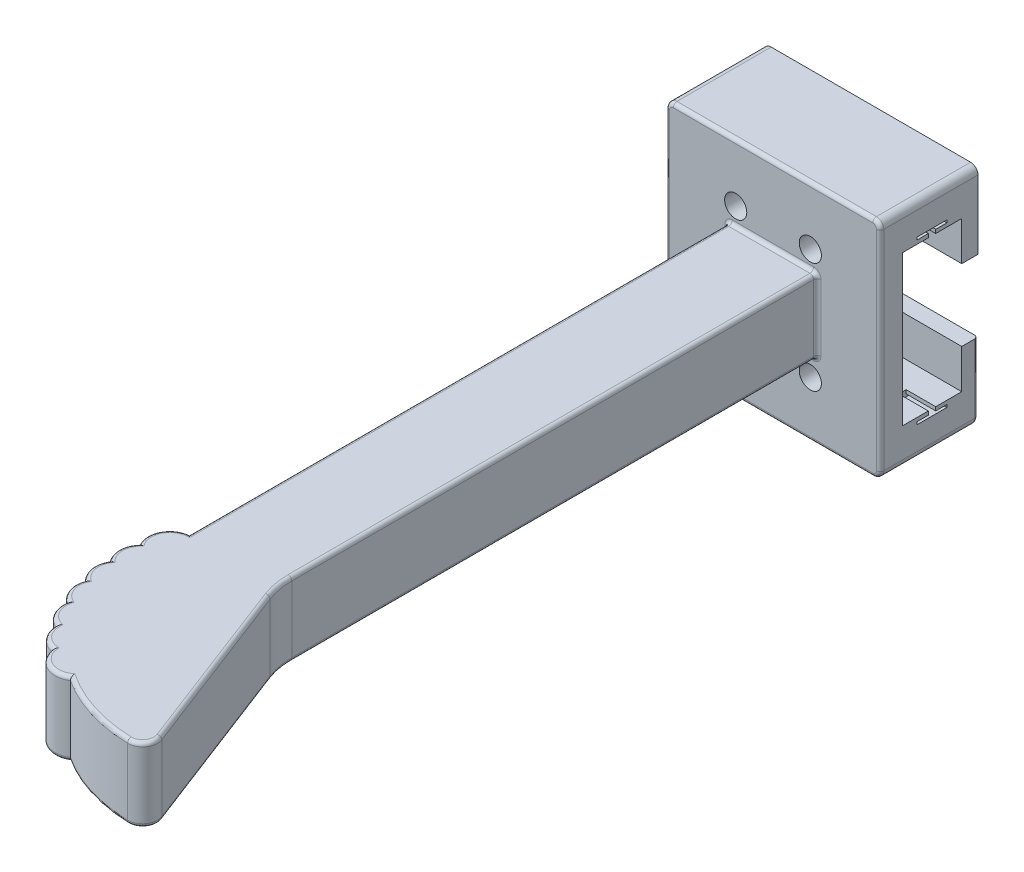
from build123d import *

# Parameters (mm, degrees)
BOSS_EXTRU_1_DEPTH           = 13.25
BOSS_EXTRU_1_2_DEPTH         = 13.25
ESQUISSE2_W                  = 29
ESQUISSE2_H                  = 3
BOSS_EXTRU_2_DEPTH           = 20.3
ESQUISSE3_W                  = 29
ESQUISSE3_H                  = 2.2
BOSS_EXTRU_3_DEPTH           = 5.3
ENL_V_MAT_EXTRU_2_DEPTH      = 4
SYM_TRIE3_COPY_1_DEPTH       = 4
ESQUISSE5_R                  = 1.5
ENL_V_MAT_EXTRU_3_DEPTH      = 10
BOSS_EXTRU_4_DEPTH           = 5
BOSS_EXTRU_4_DEPTH_BACK      = 5
BOSS_EXTRU_5_START           = -10
BOSS_EXTRU_5_DEPTH           = 10
R_P_TITION_CIRCULAIRE1_COUNT = 7
R_P_TITION_CIRCULAIRE1_ANGLE = 60
ESQUISSE10_R                 = 1.5
ENL_V_MAT_EXTRU_4_DEPTH      = 2.2
CONG_2_R                     = 0.5
CONG_3_R                     = 0.5


with BuildPart() as part:
    # Esquisse1 → Boss.-Extru.1 (new body)
    with BuildSketch(Plane.XY):
        with BuildLine():
            Line((-14.5, 10.15), (14.5, 10.15))
            Line((14.5, 10.15), (14.5, 14.15))
            ThreePointArc((14.5, 14.15), (14.207106781, 14.857106781), (13.5, 15.15))
            Line((13.5, 15.15), (-13.5, 15.15))
            ThreePointArc((-13.5, 15.15), (-14.207106781, 14.857106781), (-14.5, 14.15))
            Line((-14.5, 14.15), (-14.5, 10.15))
        make_face()
    extrude(amount=BOSS_EXTRU_1_DEPTH)



with BuildPart() as body_2:
    # Esquisse1 → Boss.-Extru.1 2 (new body)
    with BuildSketch(Plane.XY):
        with BuildLine():
            Line((-14.5, -10.15), (14.5, -10.15))
            Line((14.5, -10.15), (14.5, -14.15))
            ThreePointArc((14.5, -14.15), (14.207106781, -14.857106781), (13.5, -15.15))
            Line((13.5, -15.15), (-13.5, -15.15))
            ThreePointArc((-13.5, -15.15), (-14.207106781, -14.857106781), (-14.5, -14.15))
            Line((-14.5, -14.15), (-14.5, -10.15))
        make_face()
    extrude(amount=BOSS_EXTRU_1_2_DEPTH)


with BuildPart() as part_1:
    add(part.part)

    add(body_2.part)  # Boss.-Extru.2 merges body 2
    # Esquisse2 → Boss.-Extru.2 (add)
    with BuildSketch(Plane.XZ.offset(-10.15)):
        with Locations((0, 11.75)):
            Rectangle(ESQUISSE2_W, ESQUISSE2_H)
    extrude(amount=BOSS_EXTRU_2_DEPTH)

    # Esquisse3 → Boss.-Extru.3 (add)
    with BuildSketch(Plane(origin=(0, -10.15, 0), x_dir=(1, 0, 0), z_dir=(0, 1, 0))):
        with Locations((0, -1.1)):
            Rectangle(ESQUISSE3_W, ESQUISSE3_H)
    boss_extru_3 = extrude(amount=BOSS_EXTRU_3_DEPTH)

    # Symétrie1: Boss.-Extru.3 across plane
    add(boss_extru_3.mirror(Plane.ZX))

    # Esquisse4 → Enlèv. mat.-Extru.2 (cut)
    with BuildSketch(Plane.ZY.offset(14.5)):
        Polygon((4.225, -10.999759806), (4.225, -10.65), (5.725, -10.65), (5.725, -10.15), (6.725, -10.15), (6.725, -10.65), (8.225, -10.65), (8.225, -10.999759806), align=None)
    enl_v_mat_extru_2 = extrude(amount=-ENL_V_MAT_EXTRU_2_DEPTH, mode=Mode.SUBTRACT)

    # Symétrie2: Enlèv. mat.-Extru.2 across plane
    add(enl_v_mat_extru_2.mirror(Plane.ZX), mode=Mode.SUBTRACT)

    # Symétrie3: Enlèv. mat.-Extru.2 across plane
    add(enl_v_mat_extru_2.mirror(Plane(origin=(0, 0, 0), x_dir=(0, 0, 1), z_dir=(1, 0, 0))), mode=Mode.SUBTRACT)

    # Symétrie3 copy 1 sketch → Symétrie3 copy 1 (cut)
    with BuildSketch(Plane(origin=(14.5, 0, 0), x_dir=(0, 0, 1), z_dir=(1, 0, 0))):
        Polygon((4.225, -10.999759806), (4.225, -10.65), (5.725, -10.65), (5.725, -10.15), (6.725, -10.15), (6.725, -10.65), (8.225, -10.65), (8.225, -10.999759806), align=None)
    extrude(amount=-SYM_TRIE3_COPY_1_DEPTH, mode=Mode.SUBTRACT)

    # Esquisse5 → Enlèv. mat.-Extru.3 (cut)
    with BuildSketch(Plane.XY.offset(13.25)):
        with Locations((5.05, 7.35)):
            Circle(ESQUISSE5_R)
        with Locations((5.05, -7.65)):
            Circle(ESQUISSE5_R)
        with Locations((-5.05, -7.65)):
            Circle(ESQUISSE5_R)
        with Locations((-5.05, 7.35)):
            Circle(ESQUISSE5_R)
    extrude(amount=-ENL_V_MAT_EXTRU_3_DEPTH, mode=Mode.SUBTRACT)

    # Esquisse6 → Boss.-Extru.4 (add, two sides: drawn at the far end of the back side and taken through both)
    with BuildSketch(Plane(origin=(0, 0, 0), x_dir=(-1, 0, 0), z_dir=(0, -1, 0)).offset(-BOSS_EXTRU_4_DEPTH_BACK)):
        with BuildLine():
            Line((6, -13.25), (-6, -13.25))
            Line((-6, -13.25), (-6, -84.394601238))
            ThreePointArc((-6, -84.394601238), (-6.167804929, -86.218865494), (-6.665588015, -87.981905644))
            Line((-6.665588015, -87.981905644), (-15.824928659, -111.815137902))
            ThreePointArc((-15.824928659, -111.815137902), (-15.592792686, -113.684815833), (-13.909989816, -114.532021344))
            ThreePointArc((-13.909989816, -114.532021344), (3.169311974, -105.406383362), (6, -86.25))
            Line((6, -86.25), (6, -13.25))
        make_face()
    extrude(amount=BOSS_EXTRU_4_DEPTH + BOSS_EXTRU_4_DEPTH_BACK)

    # Esquisse7 → Boss.-Extru.5 (add)
    with BuildSketch(Plane.XZ.offset(5).offset(BOSS_EXTRU_5_START)):
        with BuildLine():
            ThreePointArc((-6, 86.25), (-6.719779668, 89.032190986), (-7.062424079, 91.885481063))
            ThreePointArc((-7.062424079, 91.885481063), (-8.612421183, 88.67538242), (-6, 86.25))
        make_face()
    boss_extru_5 = extrude(amount=BOSS_EXTRU_5_DEPTH)

    # Répétition circulaire1: Boss.-Extru.5 ×7 about axis
    r_p_tition_circulaire1_axis = Axis((14.427061648, 0, 93.018880526), (0, 1, 0))
    for i in range(1, R_P_TITION_CIRCULAIRE1_COUNT):
        add(boss_extru_5.rotate(r_p_tition_circulaire1_axis, i * R_P_TITION_CIRCULAIRE1_ANGLE / (R_P_TITION_CIRCULAIRE1_COUNT - 1)))

    # Esquisse10 → Enlèv. mat.-Extru.4 (cut)
    with BuildSketch(Plane(origin=(0, 0, 0), x_dir=(-1, 0, 0), z_dir=(0, 0, -1))):
        with Locations((0, 7.5)):
            Circle(ESQUISSE10_R)
        with Locations((0, -7.5)):
            Circle(ESQUISSE10_R)
    extrude(amount=-ENL_V_MAT_EXTRU_4_DEPTH, mode=Mode.SUBTRACT)

    # Congé2
    # the kernel refuses this fillet: 0.5 mm, written as the material it takes off along each edge
    with BuildSketch(Plane(origin=(-6, 5, 87.5), x_dir=(0, -1, 0), z_dir=(0, 0, -1))) as cong_2_piece_1_section:
        with BuildLine():
            CenterArc((CONG_2_R, -CONG_2_R), CONG_2_R, 90, 90)
            Line((0, -CONG_2_R), (0, 0))
            Line((0, 0), (CONG_2_R, 0))
        make_face()
    cong_2_piece_1 = extrude(amount=74.25, mode=Mode.PRIVATE)
    cong_2_piece_1 = cong_2_piece_1 - Plane(origin=(-5.664352932, 4.886796499, 89.231164378), x_dir=(-0.46602371566634865, 0, 0.8847722285631089), z_dir=(0, 1, 0)) * Cylinder(3, 151, mode=Mode.PRIVATE)
    add(cong_2_piece_1, mode=Mode.SUBTRACT)
    with BuildSketch(Plane(origin=(14.427061648, 5, 93.018880526), x_dir=(-0.024028222896260387, 0, 0.9997112805727699), z_dir=(0.9997112805727699, 0, 0.024028222896260387))) as cong_2_piece_2_section:
        with BuildLine():
            CenterArc((21.519353873 - CONG_2_R, CONG_2_R), CONG_2_R, 270, 90)
            Line((21.519353873, CONG_2_R), (21.519353873, 0))
            Line((21.519353873, 0), (21.519353873 - CONG_2_R, 0))
        make_face()
    cong_2_piece_2 = revolve(axis=Axis((14.427061648, 5, 93.018880526), (0, -1, 0)), revolution_arc=34.970570308, mode=Mode.PRIVATE)
    cong_2_piece_2 = cong_2_piece_2 - Plane(origin=(1.101095951, 4.859979727, 108.524697876), x_dir=(0.533223368665452, 0, 0.8459744908146272), z_dir=(0, 1, 0)) * Cylinder(3, 87, mode=Mode.PRIVATE)
    add(cong_2_piece_2, mode=Mode.SUBTRACT)
    with BuildSketch(Plane(origin=(13.958046262, 5, 112.532598783), x_dir=(0.9334411984805426, 0, -0.3587304405528035), z_dir=(-0.3587304405528035, 0, -0.9334411984805426))) as cong_2_piece_3:
        with BuildLine():
            CenterArc((2 - CONG_2_R, CONG_2_R), CONG_2_R, 270, 90)
            Line((2, CONG_2_R), (2, 0))
            Line((2, 0), (2 - CONG_2_R, 0))
        make_face()
    revolve(axis=Axis((13.958046262, 5, 112.532598783), (0, -1, 0)), revolution_arc=112.39909676, mode=Mode.SUBTRACT)
    with BuildSketch(Plane(origin=(6.665588015, 5, 87.981905644), x_dir=(-0.9334411984805407, 0, 0.35873044055280795), z_dir=(0.35873044055280795, 0, 0.9334411984805409))) as cong_2_piece_4:
        with BuildLine():
            CenterArc((CONG_2_R, CONG_2_R), CONG_2_R, 180, 90)
            Line((0, CONG_2_R), (0, 0))
            Line((0, 0), (CONG_2_R, 0))
        make_face()
    extrude(amount=25.532655187, mode=Mode.SUBTRACT)
    with BuildSketch(Plane(origin=(16, 5, 84.394601238), x_dir=(-1, 0, 0), z_dir=(0, 0, -1))) as cong_2_piece_5:
        with BuildLine():
            CenterArc((10 + CONG_2_R, -CONG_2_R), CONG_2_R, 90, 90)
            Line((10, -CONG_2_R), (10, 0))
            Line((10, 0), (10 + CONG_2_R, 0))
        make_face()
    revolve(axis=Axis((16, 5, 84.394601238), (0, 1, 0)), revolution_arc=21.022248489, mode=Mode.SUBTRACT)
    with BuildSketch(Plane(origin=(6, 5, 13.25), x_dir=(0, -1, 0), z_dir=(0, 0, 1)), Plane(origin=(6, -5, 13.25), x_dir=(-1, 0, 0), z_dir=(0, 0, 1))) as cong_2_piece_6:
        with BuildLine():
            CenterArc((CONG_2_R, -CONG_2_R), CONG_2_R, 90, 90)
            Line((0, -CONG_2_R), (0, 0))
            Line((0, 0), (CONG_2_R, 0))
        make_face()
    extrude(amount=71.144601238, mode=Mode.SUBTRACT)
    with BuildSketch(Plane(origin=(-6, -5, 87.5), x_dir=(0, 1, 0), z_dir=(0, 0, -1))) as cong_2_piece_7_section:
        with BuildLine():
            CenterArc((CONG_2_R, CONG_2_R), CONG_2_R, 180, 90)
            Line((0, CONG_2_R), (0, 0))
            Line((0, 0), (CONG_2_R, 0))
        make_face()
    cong_2_piece_7 = extrude(amount=74.25, mode=Mode.PRIVATE)
    cong_2_piece_7 = cong_2_piece_7 - Plane(origin=(-5.664352932, -4.886796499, 89.231164378), x_dir=(-0.46602371566634865, 0, 0.8847722285631089), z_dir=(0, 1, 0)) * Cylinder(3, 151, mode=Mode.PRIVATE)
    add(cong_2_piece_7, mode=Mode.SUBTRACT)
    with BuildSketch(Plane(origin=(16, -5, 84.394601238), x_dir=(-1, 0, 0), z_dir=(0, 0, -1))) as cong_2_piece_8:
        with BuildLine():
            CenterArc((10 + CONG_2_R, CONG_2_R), CONG_2_R, 180, 90)
            Line((10, CONG_2_R), (10, 0))
            Line((10, 0), (10 + CONG_2_R, 0))
        make_face()
    revolve(axis=Axis((16, -5, 84.394601238), (0, 1, 0)), revolution_arc=21.022248489, mode=Mode.SUBTRACT)
    with BuildSketch(Plane(origin=(6.665588015, -5, 87.981905644), x_dir=(-0.9334411984805407, 0, 0.35873044055280795), z_dir=(0.35873044055280795, 0, 0.9334411984805409))) as cong_2_piece_9:
        with BuildLine():
            CenterArc((CONG_2_R, -CONG_2_R), CONG_2_R, 90, 90)
            Line((0, -CONG_2_R), (0, 0))
            Line((0, 0), (CONG_2_R, 0))
        make_face()
    extrude(amount=25.532655187, mode=Mode.SUBTRACT)
    with BuildSketch(Plane(origin=(13.958046262, -5, 112.532598783), x_dir=(0.9334411984805426, 0, -0.3587304405528035), z_dir=(-0.3587304405528035, 0, -0.9334411984805426))) as cong_2_piece_10:
        with BuildLine():
            CenterArc((2 - CONG_2_R, -CONG_2_R), CONG_2_R, 0, 90)
            Line((2, -CONG_2_R), (2, 0))
            Line((2, 0), (2 - CONG_2_R, 0))
        make_face()
    revolve(axis=Axis((13.958046262, -5, 112.532598783), (0, -1, 0)), revolution_arc=112.39909676, mode=Mode.SUBTRACT)
    with BuildSketch(Plane(origin=(14.427061648, -5, 93.018880526), x_dir=(-0.024028222896260387, 0, 0.9997112805727699), z_dir=(0.9997112805727699, 0, 0.024028222896260387))) as cong_2_piece_11_section:
        with BuildLine():
            CenterArc((21.519353873 - CONG_2_R, -CONG_2_R), CONG_2_R, 0, 90)
            Line((21.519353873, -CONG_2_R), (21.519353873, 0))
            Line((21.519353873, 0), (21.519353873 - CONG_2_R, 0))
        make_face()
    cong_2_piece_11 = revolve(axis=Axis((14.427061648, -5, 93.018880526), (0, -1, 0)), revolution_arc=34.970570308, mode=Mode.PRIVATE)
    cong_2_piece_11 = cong_2_piece_11 - Plane(origin=(1.101095951, -4.859979727, 108.524697876), x_dir=(0.533223368665452, 0, 0.8459744908146272), z_dir=(0, 1, 0)) * Cylinder(3, 87, mode=Mode.PRIVATE)
    add(cong_2_piece_11, mode=Mode.SUBTRACT)
    with BuildSketch(Plane(origin=(-5.664352932, -5, 89.231164378), x_dir=(-0.5785401490158647, 0, 0.8156539069830421), z_dir=(0.8156539069830421, 0, 0.5785401490158647))) as cong_2_piece_12_section:
        with BuildLine():
            CenterArc((3 - CONG_2_R, -CONG_2_R), CONG_2_R, 0, 90)
            Line((3, -CONG_2_R), (3, 0))
            Line((3, 0), (3 - CONG_2_R, 0))
        make_face()
    cong_2_piece_12 = revolve(axis=Axis((-5.664352932, -5, 89.231164378), (0, -1, 0)), revolution_arc=162.116956249, mode=Mode.PRIVATE)
    cong_2_piece_12 = split(cong_2_piece_12, bisect_by=Plane(origin=(-6, -4.858604511, 87.95984189), z_dir=(-1, 0, 0)), keep=Keep.TOP, mode=Mode.PRIVATE)
    cong_2_piece_12 = cong_2_piece_12 - Plane(origin=(-6.016849206, -4.858604511, 92.777545825), x_dir=(-0.305304683135484, 0, 0.9522547193138723), z_dir=(0, 1, 0)) * Cylinder(3, 12, mode=Mode.PRIVATE)
    add(cong_2_piece_12, mode=Mode.SUBTRACT)
    with BuildSketch(Plane(origin=(-5.664352932, 5, 89.231164378), x_dir=(-0.5785401490158647, 0, 0.8156539069830421), z_dir=(0.8156539069830421, 0, 0.5785401490158647))) as cong_2_piece_13_section:
        with BuildLine():
            CenterArc((3 - CONG_2_R, CONG_2_R), CONG_2_R, 270, 90)
            Line((3, CONG_2_R), (3, 0))
            Line((3, 0), (3 - CONG_2_R, 0))
        make_face()
    cong_2_piece_13 = revolve(axis=Axis((-5.664352932, 5, 89.231164378), (0, -1, 0)), revolution_arc=162.116956249, mode=Mode.PRIVATE)
    cong_2_piece_13 = split(cong_2_piece_13, bisect_by=Plane(origin=(-6, 4.858604511, 87.95984189), z_dir=(-1, 0, 0)), keep=Keep.TOP, mode=Mode.PRIVATE)
    cong_2_piece_13 = cong_2_piece_13 - Plane(origin=(-6.016849206, 4.858604511, 92.777545825), x_dir=(-0.305304683135484, 0, 0.9522547193138723), z_dir=(0, 1, 0)) * Cylinder(3, 12, mode=Mode.PRIVATE)
    add(cong_2_piece_13, mode=Mode.SUBTRACT)
    with BuildSketch(Plane(origin=(-6.016849206, -5, 92.777545825), x_dir=(-0.4282299207787506, 0, 0.903669815225575), z_dir=(0.903669815225575, 0, 0.4282299207787506))) as cong_2_piece_14_section:
        with BuildLine():
            CenterArc((3 - CONG_2_R, -CONG_2_R), CONG_2_R, 0, 90)
            Line((3, -CONG_2_R), (3, 0))
            Line((3, 0), (3 - CONG_2_R, 0))
        make_face()
    cong_2_piece_14 = revolve(axis=Axis((-6.016849206, -5, 92.777545825), (0, -1, 0)), revolution_arc=130.642101132, mode=Mode.PRIVATE)
    cong_2_piece_14 = cong_2_piece_14 - Plane(origin=(-5.664352932, -4.858079971, 89.231164378), x_dir=(-0.46602371566634865, 0, 0.8847722285631089), z_dir=(0, 1, 0)) * Cylinder(3, 12, mode=Mode.PRIVATE)
    cong_2_piece_14 = cong_2_piece_14 - Plane(origin=(-5.748167594, -4.858079971, 96.331260106), x_dir=(-0.1353091222991715, 0, 0.990803432282422), z_dir=(0, 1, 0)) * Cylinder(3, 12, mode=Mode.PRIVATE)
    add(cong_2_piece_14, mode=Mode.SUBTRACT)
    with BuildSketch(Plane(origin=(-6.016849206, 5, 92.777545825), x_dir=(-0.4282299207787506, 0, 0.903669815225575), z_dir=(0.903669815225575, 0, 0.4282299207787506))) as cong_2_piece_15_section:
        with BuildLine():
            CenterArc((3 - CONG_2_R, CONG_2_R), CONG_2_R, 270, 90)
            Line((3, CONG_2_R), (3, 0))
            Line((3, 0), (3 - CONG_2_R, 0))
        make_face()
    cong_2_piece_15 = revolve(axis=Axis((-6.016849206, 5, 92.777545825), (0, -1, 0)), revolution_arc=130.642101132, mode=Mode.PRIVATE)
    cong_2_piece_15 = cong_2_piece_15 - Plane(origin=(-5.664352932, 4.858079971, 89.231164378), x_dir=(-0.46602371566634865, 0, 0.8847722285631089), z_dir=(0, 1, 0)) * Cylinder(3, 12, mode=Mode.PRIVATE)
    cong_2_piece_15 = cong_2_piece_15 - Plane(origin=(-5.748167594, 4.858079971, 96.331260106), x_dir=(-0.1353091222991715, 0, 0.990803432282422), z_dir=(0, 1, 0)) * Cylinder(3, 12, mode=Mode.PRIVATE)
    add(cong_2_piece_15, mode=Mode.SUBTRACT)
    with BuildSketch(Plane(origin=(-5.748167594, 5, 96.331260106), x_dir=(-0.26480352942816976, 0, 0.9643023855629438), z_dir=(0.9643023855629438, 0, 0.26480352942816976))) as cong_2_piece_16_section:
        with BuildLine():
            CenterArc((3 - CONG_2_R, CONG_2_R), CONG_2_R, 270, 90)
            Line((3, CONG_2_R), (3, 0))
            Line((3, 0), (3 - CONG_2_R, 0))
        make_face()
    cong_2_piece_16 = revolve(axis=Axis((-5.748167594, 5, 96.331260106), (0, -1, 0)), revolution_arc=130.642101132, mode=Mode.PRIVATE)
    cong_2_piece_16 = cong_2_piece_16 - Plane(origin=(-4.866471851, 4.858079971, 99.784329409), x_dir=(0.03879773774848172, 0, 0.9992470843317984), z_dir=(0, 1, 0)) * Cylinder(3, 12, mode=Mode.PRIVATE)
    cong_2_piece_16 = cong_2_piece_16 - Plane(origin=(-6.016849206, 4.858079971, 92.777545825), x_dir=(-0.305304683135484, 0, 0.9522547193138723), z_dir=(0, 1, 0)) * Cylinder(3, 12, mode=Mode.PRIVATE)
    add(cong_2_piece_16, mode=Mode.SUBTRACT)
    with BuildSketch(Plane(origin=(-4.866471851, 5, 99.784329409), x_dir=(-0.09333121683297944, 0, 0.9956351158755278), z_dir=(0.9956351158755278, 0, 0.09333121683297944))) as cong_2_piece_17_section:
        with BuildLine():
            CenterArc((3 - CONG_2_R, CONG_2_R), CONG_2_R, 270, 90)
            Line((3, CONG_2_R), (3, 0))
            Line((3, 0), (3 - CONG_2_R, 0))
        make_face()
    cong_2_piece_17 = revolve(axis=Axis((-4.866471851, 5, 99.784329409), (0, -1, 0)), revolution_arc=130.642101132, mode=Mode.PRIVATE)
    cong_2_piece_17 = cong_2_piece_17 - Plane(origin=(-3.398551855, 4.858079971, 103.031833971), x_dir=(0.21172574816724976, 0, 0.9773291193671753), z_dir=(0, 1, 0)) * Cylinder(3, 13, mode=Mode.PRIVATE)
    cong_2_piece_17 = cong_2_piece_17 - Plane(origin=(-5.748167594, 4.858079971, 96.331260106), x_dir=(-0.1353091222991715, 0, 0.990803432282422), z_dir=(0, 1, 0)) * Cylinder(3, 13, mode=Mode.PRIVATE)
    add(cong_2_piece_17, mode=Mode.SUBTRACT)
    with BuildSketch(Plane(origin=(-3.398551855, 5, 103.031833971), x_dir=(0.08097691755779625, 0, 0.9967159770079127), z_dir=(0.9967159770079127, 0, -0.08097691755779625))) as cong_2_piece_18_section:
        with BuildLine():
            CenterArc((3 - CONG_2_R, CONG_2_R), CONG_2_R, 270, 90)
            Line((3, CONG_2_R), (3, 0))
            Line((3, 0), (3 - CONG_2_R, 0))
        make_face()
    cong_2_piece_18 = revolve(axis=Axis((-3.398551855, 5, 103.031833971), (0, -1, 0)), revolution_arc=130.642101132, mode=Mode.PRIVATE)
    cong_2_piece_18 = cong_2_piece_18 - Plane(origin=(-1.389009613, 4.858079971, 105.97510001), x_dir=(0.37822057886635413, 0, 0.9257155036629775), z_dir=(0, 1, 0)) * Cylinder(3, 13, mode=Mode.PRIVATE)
    cong_2_piece_18 = cong_2_piece_18 - Plane(origin=(-4.866471851, 4.858079971, 99.784329409), x_dir=(0.03879773774848172, 0, 0.9992470843317984), z_dir=(0, 1, 0)) * Cylinder(3, 13, mode=Mode.PRIVATE)
    add(cong_2_piece_18, mode=Mode.SUBTRACT)
    with BuildSketch(Plane(origin=(-1.389009613, 5, 105.97510001), x_dir=(0.252824609284887, 0, 0.9675121275415334), z_dir=(0.9675121275415334, 0, -0.252824609284887))) as cong_2_piece_19_section:
        with BuildLine():
            CenterArc((3 - CONG_2_R, CONG_2_R), CONG_2_R, 270, 90)
            Line((3, CONG_2_R), (3, 0))
            Line((3, 0), (3 - CONG_2_R, 0))
        make_face()
    cong_2_piece_19 = revolve(axis=Axis((-1.389009613, 5, 105.97510001), (0, -1, 0)), revolution_arc=130.642101132, mode=Mode.PRIVATE)
    cong_2_piece_19 = cong_2_piece_19 - Plane(origin=(-3.398551855, 4.858079971, 103.031833971), x_dir=(0.21172574816724976, 0, 0.9773291193671753), z_dir=(0, 1, 0)) * Cylinder(3, 12, mode=Mode.PRIVATE)
    cong_2_piece_19 = cong_2_piece_19 - Plane(origin=(1.101095951, 4.858079971, 108.524697876), x_dir=(0.533223368665452, 0, 0.8459744908146272), z_dir=(0, 1, 0)) * Cylinder(3, 12, mode=Mode.PRIVATE)
    add(cong_2_piece_19, mode=Mode.SUBTRACT)
    with BuildSketch(Plane(origin=(1.101095951, 5, 108.524697876), x_dir=(0.8301312932723901, 0, 0.5575679653010107), z_dir=(0.5575679653010107, 0, -0.8301312932723901))) as cong_2_piece_20_section:
        with BuildLine():
            CenterArc((3 - CONG_2_R, CONG_2_R), CONG_2_R, 270, 90)
            Line((3, CONG_2_R), (3, 0))
            Line((3, 0), (3 - CONG_2_R, 0))
        make_face()
    cong_2_piece_20 = revolve(axis=Axis((1.101095951, 5, 108.524697876), (0, -1, 0)), revolution_arc=162.116956249, mode=Mode.PRIVATE)
    cong_2_piece_20 = cong_2_piece_20 - Plane(origin=(-1.389009613, 4.858592965, 105.97510001), x_dir=(0.37822057886635413, 0, 0.9257155036629775), z_dir=(0, 1, 0)) * Cylinder(3, 12, mode=Mode.PRIVATE)
    cong_2_piece_20 = cong_2_piece_20 - Plane(origin=(14.427061648, 4.858592965, 93.018880526), x_dir=(-0.02402822289626039, 0, 0.99971128057277), z_dir=(0, 1, 0)) * Cylinder(21.519353873, 12, mode=Mode.PRIVATE)
    add(cong_2_piece_20, mode=Mode.SUBTRACT)
    with BuildSketch(Plane(origin=(-5.748167594, -5, 96.331260106), x_dir=(-0.26480352942816976, 0, 0.9643023855629438), z_dir=(0.9643023855629438, 0, 0.26480352942816976))) as cong_2_piece_21_section:
        with BuildLine():
            CenterArc((3 - CONG_2_R, -CONG_2_R), CONG_2_R, 0, 90)
            Line((3, -CONG_2_R), (3, 0))
            Line((3, 0), (3 - CONG_2_R, 0))
        make_face()
    cong_2_piece_21 = revolve(axis=Axis((-5.748167594, -5, 96.331260106), (0, -1, 0)), revolution_arc=130.642101132, mode=Mode.PRIVATE)
    cong_2_piece_21 = cong_2_piece_21 - Plane(origin=(-4.866471851, -4.858079971, 99.784329409), x_dir=(0.03879773774848172, 0, 0.9992470843317984), z_dir=(0, 1, 0)) * Cylinder(3, 12, mode=Mode.PRIVATE)
    cong_2_piece_21 = cong_2_piece_21 - Plane(origin=(-6.016849206, -4.858079971, 92.777545825), x_dir=(-0.305304683135484, 0, 0.9522547193138723), z_dir=(0, 1, 0)) * Cylinder(3, 12, mode=Mode.PRIVATE)
    add(cong_2_piece_21, mode=Mode.SUBTRACT)
    with BuildSketch(Plane(origin=(-4.866471851, -5, 99.784329409), x_dir=(-0.09333121683297944, 0, 0.9956351158755278), z_dir=(0.9956351158755278, 0, 0.09333121683297944))) as cong_2_piece_22_section:
        with BuildLine():
            CenterArc((3 - CONG_2_R, -CONG_2_R), CONG_2_R, 0, 90)
            Line((3, -CONG_2_R), (3, 0))
            Line((3, 0), (3 - CONG_2_R, 0))
        make_face()
    cong_2_piece_22 = revolve(axis=Axis((-4.866471851, -5, 99.784329409), (0, -1, 0)), revolution_arc=130.642101132, mode=Mode.PRIVATE)
    cong_2_piece_22 = cong_2_piece_22 - Plane(origin=(-3.398551855, -4.858079971, 103.031833971), x_dir=(0.21172574816724976, 0, 0.9773291193671753), z_dir=(0, 1, 0)) * Cylinder(3, 13, mode=Mode.PRIVATE)
    cong_2_piece_22 = cong_2_piece_22 - Plane(origin=(-5.748167594, -4.858079971, 96.331260106), x_dir=(-0.1353091222991715, 0, 0.990803432282422), z_dir=(0, 1, 0)) * Cylinder(3, 13, mode=Mode.PRIVATE)
    add(cong_2_piece_22, mode=Mode.SUBTRACT)
    with BuildSketch(Plane(origin=(-3.398551855, -5, 103.031833971), x_dir=(0.08097691755779625, 0, 0.9967159770079127), z_dir=(0.9967159770079127, 0, -0.08097691755779625))) as cong_2_piece_23_section:
        with BuildLine():
            CenterArc((3 - CONG_2_R, -CONG_2_R), CONG_2_R, 0, 90)
            Line((3, -CONG_2_R), (3, 0))
            Line((3, 0), (3 - CONG_2_R, 0))
        make_face()
    cong_2_piece_23 = revolve(axis=Axis((-3.398551855, -5, 103.031833971), (0, -1, 0)), revolution_arc=130.642101132, mode=Mode.PRIVATE)
    cong_2_piece_23 = cong_2_piece_23 - Plane(origin=(-1.389009613, -4.858079971, 105.97510001), x_dir=(0.37822057886635413, 0, 0.9257155036629775), z_dir=(0, 1, 0)) * Cylinder(3, 13, mode=Mode.PRIVATE)
    cong_2_piece_23 = cong_2_piece_23 - Plane(origin=(-4.866471851, -4.858079971, 99.784329409), x_dir=(0.03879773774848172, 0, 0.9992470843317984), z_dir=(0, 1, 0)) * Cylinder(3, 13, mode=Mode.PRIVATE)
    add(cong_2_piece_23, mode=Mode.SUBTRACT)
    with BuildSketch(Plane(origin=(-1.389009613, -5, 105.97510001), x_dir=(0.252824609284887, 0, 0.9675121275415334), z_dir=(0.9675121275415334, 0, -0.252824609284887))) as cong_2_piece_24_section:
        with BuildLine():
            CenterArc((3 - CONG_2_R, -CONG_2_R), CONG_2_R, 0, 90)
            Line((3, -CONG_2_R), (3, 0))
            Line((3, 0), (3 - CONG_2_R, 0))
        make_face()
    cong_2_piece_24 = revolve(axis=Axis((-1.389009613, -5, 105.97510001), (0, -1, 0)), revolution_arc=130.642101132, mode=Mode.PRIVATE)
    cong_2_piece_24 = cong_2_piece_24 - Plane(origin=(-3.398551855, -4.858079971, 103.031833971), x_dir=(0.21172574816724976, 0, 0.9773291193671753), z_dir=(0, 1, 0)) * Cylinder(3, 12, mode=Mode.PRIVATE)
    cong_2_piece_24 = cong_2_piece_24 - Plane(origin=(1.101095951, -4.858079971, 108.524697876), x_dir=(0.533223368665452, 0, 0.8459744908146272), z_dir=(0, 1, 0)) * Cylinder(3, 12, mode=Mode.PRIVATE)
    add(cong_2_piece_24, mode=Mode.SUBTRACT)
    with BuildSketch(Plane(origin=(1.101095951, -5, 108.524697876), x_dir=(0.8301312932723901, 0, 0.5575679653010107), z_dir=(0.5575679653010107, 0, -0.8301312932723901))) as cong_2_piece_25_section:
        with BuildLine():
            CenterArc((3 - CONG_2_R, -CONG_2_R), CONG_2_R, 0, 90)
            Line((3, -CONG_2_R), (3, 0))
            Line((3, 0), (3 - CONG_2_R, 0))
        make_face()
    cong_2_piece_25 = revolve(axis=Axis((1.101095951, -5, 108.524697876), (0, -1, 0)), revolution_arc=162.116956249, mode=Mode.PRIVATE)
    cong_2_piece_25 = cong_2_piece_25 - Plane(origin=(-1.389009613, -4.858592965, 105.97510001), x_dir=(0.37822057886635413, 0, 0.9257155036629775), z_dir=(0, 1, 0)) * Cylinder(3, 12, mode=Mode.PRIVATE)
    cong_2_piece_25 = cong_2_piece_25 - Plane(origin=(14.427061648, -4.858592965, 93.018880526), x_dir=(-0.02402822289626039, 0, 0.99971128057277), z_dir=(0, 1, 0)) * Cylinder(21.519353873, 12, mode=Mode.PRIVATE)
    add(cong_2_piece_25, mode=Mode.SUBTRACT)
    with BuildSketch(Plane(origin=(-6, 5, 87.5), x_dir=(0, -1, 0), z_dir=(0, 0, -1))) as cong_2_piece_26a_section:
        with BuildLine():
            CenterArc((CONG_2_R, -CONG_2_R), CONG_2_R, 90, 90)
            Line((0, -CONG_2_R), (0, 0))
            Line((0, 0), (CONG_2_R, 0))
        make_face()
    cong_2_piece_26a = extrude(amount=74.25, mode=Mode.PRIVATE)
    cong_2_piece_26a = cong_2_piece_26a & Plane(origin=(-5.664352932, 4.887146211, 89.231164378), x_dir=(-0.46602371566634865, 0, 0.8847722285631089), z_dir=(0, 1, 0)) * Cylinder(3, 151, mode=Mode.PRIVATE)
    with BuildSketch(Plane(origin=(-5.664352932, 5, 89.231164378), x_dir=(-0.5785401490158647, 0, 0.8156539069830421), z_dir=(0.8156539069830421, 0, 0.5785401490158647))) as cong_2_piece_26b_section:
        with BuildLine():
            CenterArc((3 - CONG_2_R, CONG_2_R), CONG_2_R, 270, 90)
            Line((3, CONG_2_R), (3, 0))
            Line((3, 0), (3 - CONG_2_R, 0))
        make_face()
    cong_2_piece_26b = revolve(axis=Axis((-5.664352932, 5, 89.231164378), (0, -1, 0)), revolution_arc=162.116956249, mode=Mode.PRIVATE)
    cong_2_piece_26b = split(cong_2_piece_26b, bisect_by=Plane(origin=(-6, 4.885085409, 86.375499734), z_dir=(1, 0, 0)), keep=Keep.TOP, mode=Mode.PRIVATE)
    cong_2_piece_26 = cong_2_piece_26a & cong_2_piece_26b
    add(cong_2_piece_26, mode=Mode.SUBTRACT)
    with BuildSketch(Plane(origin=(14.427061648, 5, 93.018880526), x_dir=(-0.024028222896260387, 0, 0.9997112805727699), z_dir=(0.9997112805727699, 0, 0.024028222896260387))) as cong_2_piece_27a_section:
        with BuildLine():
            CenterArc((21.519353873 - CONG_2_R, CONG_2_R), CONG_2_R, 270, 90)
            Line((21.519353873, CONG_2_R), (21.519353873, 0))
            Line((21.519353873, 0), (21.519353873 - CONG_2_R, 0))
        make_face()
    cong_2_piece_27a = revolve(axis=Axis((14.427061648, 5, 93.018880526), (0, -1, 0)), revolution_arc=34.970570308, mode=Mode.PRIVATE)
    cong_2_piece_27a = cong_2_piece_27a & Plane(origin=(1.101095951, 4.888616334, 108.524697876), x_dir=(0.533223368665452, 0, 0.8459744908146272), z_dir=(0, 1, 0)) * Cylinder(3, 87, mode=Mode.PRIVATE)
    with BuildSketch(Plane(origin=(1.101095951, 5, 108.524697876), x_dir=(0.8301312932723901, 0, 0.5575679653010107), z_dir=(0.5575679653010107, 0, -0.8301312932723901))) as cong_2_piece_27b_section:
        with BuildLine():
            CenterArc((3 - CONG_2_R, CONG_2_R), CONG_2_R, 270, 90)
            Line((3, CONG_2_R), (3, 0))
            Line((3, 0), (3 - CONG_2_R, 0))
        make_face()
    cong_2_piece_27b = revolve(axis=Axis((1.101095951, 5, 108.524697876), (0, -1, 0)), revolution_arc=162.116956249, mode=Mode.PRIVATE)
    cong_2_piece_27b = cong_2_piece_27b & Plane(origin=(14.427061648, 4.887023548, 93.018880526), x_dir=(-0.02402822289626039, 0, 0.99971128057277), z_dir=(0, 1, 0)) * Cylinder(21.519353873, 12, mode=Mode.PRIVATE)
    cong_2_piece_27 = cong_2_piece_27a & cong_2_piece_27b
    add(cong_2_piece_27, mode=Mode.SUBTRACT)
    with BuildSketch(Plane(origin=(-6, -5, 87.5), x_dir=(0, 1, 0), z_dir=(0, 0, -1))) as cong_2_piece_28a_section:
        with BuildLine():
            CenterArc((CONG_2_R, CONG_2_R), CONG_2_R, 180, 90)
            Line((0, CONG_2_R), (0, 0))
            Line((0, 0), (CONG_2_R, 0))
        make_face()
    cong_2_piece_28a = extrude(amount=74.25, mode=Mode.PRIVATE)
    cong_2_piece_28a = cong_2_piece_28a & Plane(origin=(-5.664352932, -4.887146211, 89.231164378), x_dir=(-0.46602371566634865, 0, 0.8847722285631089), z_dir=(0, 1, 0)) * Cylinder(3, 151, mode=Mode.PRIVATE)
    with BuildSketch(Plane(origin=(-5.664352932, -5, 89.231164378), x_dir=(-0.5785401490158647, 0, 0.8156539069830421), z_dir=(0.8156539069830421, 0, 0.5785401490158647))) as cong_2_piece_28b_section:
        with BuildLine():
            CenterArc((3 - CONG_2_R, -CONG_2_R), CONG_2_R, 0, 90)
            Line((3, -CONG_2_R), (3, 0))
            Line((3, 0), (3 - CONG_2_R, 0))
        make_face()
    cong_2_piece_28b = revolve(axis=Axis((-5.664352932, -5, 89.231164378), (0, -1, 0)), revolution_arc=162.116956249, mode=Mode.PRIVATE)
    cong_2_piece_28b = split(cong_2_piece_28b, bisect_by=Plane(origin=(-6, -4.885085409, 86.375499734), z_dir=(1, 0, 0)), keep=Keep.TOP, mode=Mode.PRIVATE)
    cong_2_piece_28 = cong_2_piece_28a & cong_2_piece_28b
    add(cong_2_piece_28, mode=Mode.SUBTRACT)
    with BuildSketch(Plane(origin=(14.427061648, -5, 93.018880526), x_dir=(-0.024028222896260387, 0, 0.9997112805727699), z_dir=(0.9997112805727699, 0, 0.024028222896260387))) as cong_2_piece_29a_section:
        with BuildLine():
            CenterArc((21.519353873 - CONG_2_R, -CONG_2_R), CONG_2_R, 0, 90)
            Line((21.519353873, -CONG_2_R), (21.519353873, 0))
            Line((21.519353873, 0), (21.519353873 - CONG_2_R, 0))
        make_face()
    cong_2_piece_29a = revolve(axis=Axis((14.427061648, -5, 93.018880526), (0, -1, 0)), revolution_arc=34.970570308, mode=Mode.PRIVATE)
    cong_2_piece_29a = cong_2_piece_29a & Plane(origin=(1.101095951, -4.888616334, 108.524697876), x_dir=(0.533223368665452, 0, 0.8459744908146272), z_dir=(0, 1, 0)) * Cylinder(3, 87, mode=Mode.PRIVATE)
    with BuildSketch(Plane(origin=(1.101095951, -5, 108.524697876), x_dir=(0.8301312932723901, 0, 0.5575679653010107), z_dir=(0.5575679653010107, 0, -0.8301312932723901))) as cong_2_piece_29b_section:
        with BuildLine():
            CenterArc((3 - CONG_2_R, -CONG_2_R), CONG_2_R, 0, 90)
            Line((3, -CONG_2_R), (3, 0))
            Line((3, 0), (3 - CONG_2_R, 0))
        make_face()
    cong_2_piece_29b = revolve(axis=Axis((1.101095951, -5, 108.524697876), (0, -1, 0)), revolution_arc=162.116956249, mode=Mode.PRIVATE)
    cong_2_piece_29b = cong_2_piece_29b & Plane(origin=(14.427061648, -4.887023548, 93.018880526), x_dir=(-0.02402822289626039, 0, 0.99971128057277), z_dir=(0, 1, 0)) * Cylinder(21.519353873, 12, mode=Mode.PRIVATE)
    cong_2_piece_29 = cong_2_piece_29a & cong_2_piece_29b
    add(cong_2_piece_29, mode=Mode.SUBTRACT)
    with BuildSketch(Plane(origin=(-6.016849206, -5, 92.777545825), x_dir=(-0.4282299207787506, 0, 0.903669815225575), z_dir=(0.903669815225575, 0, 0.4282299207787506))) as cong_2_piece_30a_section:
        with BuildLine():
            CenterArc((3 - CONG_2_R, -CONG_2_R), CONG_2_R, 0, 90)
            Line((3, -CONG_2_R), (3, 0))
            Line((3, 0), (3 - CONG_2_R, 0))
        make_face()
    cong_2_piece_30a = revolve(axis=Axis((-6.016849206, -5, 92.777545825), (0, -1, 0)), revolution_arc=130.642101132, mode=Mode.PRIVATE)
    cong_2_piece_30a = cong_2_piece_30a & Plane(origin=(-5.664352932, -4.885897688, 89.231164378), x_dir=(-0.46602371566634865, 0, 0.8847722285631089), z_dir=(0, 1, 0)) * Cylinder(3, 12, mode=Mode.PRIVATE)
    with BuildSketch(Plane(origin=(-5.664352932, -5, 89.231164378), x_dir=(-0.5785401490158647, 0, 0.8156539069830421), z_dir=(0.8156539069830421, 0, 0.5785401490158647))) as cong_2_piece_30b_section:
        with BuildLine():
            CenterArc((3 - CONG_2_R, -CONG_2_R), CONG_2_R, 0, 90)
            Line((3, -CONG_2_R), (3, 0))
            Line((3, 0), (3 - CONG_2_R, 0))
        make_face()
    cong_2_piece_30b = revolve(axis=Axis((-5.664352932, -5, 89.231164378), (0, -1, 0)), revolution_arc=162.116956249, mode=Mode.PRIVATE)
    cong_2_piece_30b = cong_2_piece_30b & Plane(origin=(-6.016849206, -4.885897247, 92.777545825), x_dir=(-0.305304683135484, 0, 0.9522547193138723), z_dir=(0, 1, 0)) * Cylinder(3, 12, mode=Mode.PRIVATE)
    cong_2_piece_30 = cong_2_piece_30a & cong_2_piece_30b
    add(cong_2_piece_30, mode=Mode.SUBTRACT)
    with BuildSketch(Plane(origin=(-6.016849206, 5, 92.777545825), x_dir=(-0.4282299207787506, 0, 0.903669815225575), z_dir=(0.903669815225575, 0, 0.4282299207787506))) as cong_2_piece_31a_section:
        with BuildLine():
            CenterArc((3 - CONG_2_R, CONG_2_R), CONG_2_R, 270, 90)
            Line((3, CONG_2_R), (3, 0))
            Line((3, 0), (3 - CONG_2_R, 0))
        make_face()
    cong_2_piece_31a = revolve(axis=Axis((-6.016849206, 5, 92.777545825), (0, -1, 0)), revolution_arc=130.642101132, mode=Mode.PRIVATE)
    cong_2_piece_31a = cong_2_piece_31a & Plane(origin=(-5.664352932, 4.885897688, 89.231164378), x_dir=(-0.46602371566634865, 0, 0.8847722285631089), z_dir=(0, 1, 0)) * Cylinder(3, 12, mode=Mode.PRIVATE)
    with BuildSketch(Plane(origin=(-5.664352932, 5, 89.231164378), x_dir=(-0.5785401490158647, 0, 0.8156539069830421), z_dir=(0.8156539069830421, 0, 0.5785401490158647))) as cong_2_piece_31b_section:
        with BuildLine():
            CenterArc((3 - CONG_2_R, CONG_2_R), CONG_2_R, 270, 90)
            Line((3, CONG_2_R), (3, 0))
            Line((3, 0), (3 - CONG_2_R, 0))
        make_face()
    cong_2_piece_31b = revolve(axis=Axis((-5.664352932, 5, 89.231164378), (0, -1, 0)), revolution_arc=162.116956249, mode=Mode.PRIVATE)
    cong_2_piece_31b = cong_2_piece_31b & Plane(origin=(-6.016849206, 4.885897247, 92.777545825), x_dir=(-0.305304683135484, 0, 0.9522547193138723), z_dir=(0, 1, 0)) * Cylinder(3, 12, mode=Mode.PRIVATE)
    cong_2_piece_31 = cong_2_piece_31a & cong_2_piece_31b
    add(cong_2_piece_31, mode=Mode.SUBTRACT)
    with BuildSketch(Plane(origin=(-5.748167594, -5, 96.331260106), x_dir=(-0.26480352942816976, 0, 0.9643023855629438), z_dir=(0.9643023855629438, 0, 0.26480352942816976))) as cong_2_piece_32a_section:
        with BuildLine():
            CenterArc((3 - CONG_2_R, -CONG_2_R), CONG_2_R, 0, 90)
            Line((3, -CONG_2_R), (3, 0))
            Line((3, 0), (3 - CONG_2_R, 0))
        make_face()
    cong_2_piece_32a = revolve(axis=Axis((-5.748167594, -5, 96.331260106), (0, -1, 0)), revolution_arc=130.642101132, mode=Mode.PRIVATE)
    cong_2_piece_32a = cong_2_piece_32a & Plane(origin=(-6.016849206, -4.885897688, 92.777545825), x_dir=(-0.305304683135484, 0, 0.9522547193138723), z_dir=(0, 1, 0)) * Cylinder(3, 12, mode=Mode.PRIVATE)
    with BuildSketch(Plane(origin=(-6.016849206, -5, 92.777545825), x_dir=(-0.4282299207787506, 0, 0.903669815225575), z_dir=(0.903669815225575, 0, 0.4282299207787506))) as cong_2_piece_32b_section:
        with BuildLine():
            CenterArc((3 - CONG_2_R, -CONG_2_R), CONG_2_R, 0, 90)
            Line((3, -CONG_2_R), (3, 0))
            Line((3, 0), (3 - CONG_2_R, 0))
        make_face()
    cong_2_piece_32b = revolve(axis=Axis((-6.016849206, -5, 92.777545825), (0, -1, 0)), revolution_arc=130.642101132, mode=Mode.PRIVATE)
    cong_2_piece_32b = cong_2_piece_32b & Plane(origin=(-5.748167594, -4.885897689, 96.331260106), x_dir=(-0.1353091222991715, 0, 0.990803432282422), z_dir=(0, 1, 0)) * Cylinder(3, 12, mode=Mode.PRIVATE)
    cong_2_piece_32 = cong_2_piece_32a & cong_2_piece_32b
    add(cong_2_piece_32, mode=Mode.SUBTRACT)
    with BuildSketch(Plane(origin=(-5.748167594, 5, 96.331260106), x_dir=(-0.26480352942816976, 0, 0.9643023855629438), z_dir=(0.9643023855629438, 0, 0.26480352942816976))) as cong_2_piece_33a_section:
        with BuildLine():
            CenterArc((3 - CONG_2_R, CONG_2_R), CONG_2_R, 270, 90)
            Line((3, CONG_2_R), (3, 0))
            Line((3, 0), (3 - CONG_2_R, 0))
        make_face()
    cong_2_piece_33a = revolve(axis=Axis((-5.748167594, 5, 96.331260106), (0, -1, 0)), revolution_arc=130.642101132, mode=Mode.PRIVATE)
    cong_2_piece_33a = cong_2_piece_33a & Plane(origin=(-6.016849206, 4.885897688, 92.777545825), x_dir=(-0.305304683135484, 0, 0.9522547193138723), z_dir=(0, 1, 0)) * Cylinder(3, 12, mode=Mode.PRIVATE)
    with BuildSketch(Plane(origin=(-6.016849206, 5, 92.777545825), x_dir=(-0.4282299207787506, 0, 0.903669815225575), z_dir=(0.903669815225575, 0, 0.4282299207787506))) as cong_2_piece_33b_section:
        with BuildLine():
            CenterArc((3 - CONG_2_R, CONG_2_R), CONG_2_R, 270, 90)
            Line((3, CONG_2_R), (3, 0))
            Line((3, 0), (3 - CONG_2_R, 0))
        make_face()
    cong_2_piece_33b = revolve(axis=Axis((-6.016849206, 5, 92.777545825), (0, -1, 0)), revolution_arc=130.642101132, mode=Mode.PRIVATE)
    cong_2_piece_33b = cong_2_piece_33b & Plane(origin=(-5.748167594, 4.885897689, 96.331260106), x_dir=(-0.1353091222991715, 0, 0.990803432282422), z_dir=(0, 1, 0)) * Cylinder(3, 12, mode=Mode.PRIVATE)
    cong_2_piece_33 = cong_2_piece_33a & cong_2_piece_33b
    add(cong_2_piece_33, mode=Mode.SUBTRACT)
    with BuildSketch(Plane(origin=(-4.866471851, 5, 99.784329409), x_dir=(-0.09333121683297944, 0, 0.9956351158755278), z_dir=(0.9956351158755278, 0, 0.09333121683297944))) as cong_2_piece_34a_section:
        with BuildLine():
            CenterArc((3 - CONG_2_R, CONG_2_R), CONG_2_R, 270, 90)
            Line((3, CONG_2_R), (3, 0))
            Line((3, 0), (3 - CONG_2_R, 0))
        make_face()
    cong_2_piece_34a = revolve(axis=Axis((-4.866471851, 5, 99.784329409), (0, -1, 0)), revolution_arc=130.642101132, mode=Mode.PRIVATE)
    cong_2_piece_34a = cong_2_piece_34a & Plane(origin=(-5.748167594, 4.885897688, 96.331260106), x_dir=(-0.1353091222991715, 0, 0.990803432282422), z_dir=(0, 1, 0)) * Cylinder(3, 13, mode=Mode.PRIVATE)
    with BuildSketch(Plane(origin=(-5.748167594, 5, 96.331260106), x_dir=(-0.26480352942816976, 0, 0.9643023855629438), z_dir=(0.9643023855629438, 0, 0.26480352942816976))) as cong_2_piece_34b_section:
        with BuildLine():
            CenterArc((3 - CONG_2_R, CONG_2_R), CONG_2_R, 270, 90)
            Line((3, CONG_2_R), (3, 0))
            Line((3, 0), (3 - CONG_2_R, 0))
        make_face()
    cong_2_piece_34b = revolve(axis=Axis((-5.748167594, 5, 96.331260106), (0, -1, 0)), revolution_arc=130.642101132, mode=Mode.PRIVATE)
    cong_2_piece_34b = cong_2_piece_34b & Plane(origin=(-4.866471851, 4.885897689, 99.784329409), x_dir=(0.03879773774848172, 0, 0.9992470843317984), z_dir=(0, 1, 0)) * Cylinder(3, 12, mode=Mode.PRIVATE)
    cong_2_piece_34 = cong_2_piece_34a & cong_2_piece_34b
    add(cong_2_piece_34, mode=Mode.SUBTRACT)
    with BuildSketch(Plane(origin=(-3.398551855, 5, 103.031833971), x_dir=(0.08097691755779625, 0, 0.9967159770079127), z_dir=(0.9967159770079127, 0, -0.08097691755779625))) as cong_2_piece_35a_section:
        with BuildLine():
            CenterArc((3 - CONG_2_R, CONG_2_R), CONG_2_R, 270, 90)
            Line((3, CONG_2_R), (3, 0))
            Line((3, 0), (3 - CONG_2_R, 0))
        make_face()
    cong_2_piece_35a = revolve(axis=Axis((-3.398551855, 5, 103.031833971), (0, -1, 0)), revolution_arc=130.642101132, mode=Mode.PRIVATE)
    cong_2_piece_35a = cong_2_piece_35a & Plane(origin=(-4.866471851, 4.885897688, 99.784329409), x_dir=(0.03879773774848172, 0, 0.9992470843317984), z_dir=(0, 1, 0)) * Cylinder(3, 13, mode=Mode.PRIVATE)
    with BuildSketch(Plane(origin=(-4.866471851, 5, 99.784329409), x_dir=(-0.09333121683297944, 0, 0.9956351158755278), z_dir=(0.9956351158755278, 0, 0.09333121683297944))) as cong_2_piece_35b_section:
        with BuildLine():
            CenterArc((3 - CONG_2_R, CONG_2_R), CONG_2_R, 270, 90)
            Line((3, CONG_2_R), (3, 0))
            Line((3, 0), (3 - CONG_2_R, 0))
        make_face()
    cong_2_piece_35b = revolve(axis=Axis((-4.866471851, 5, 99.784329409), (0, -1, 0)), revolution_arc=130.642101132, mode=Mode.PRIVATE)
    cong_2_piece_35b = cong_2_piece_35b & Plane(origin=(-3.398551855, 4.885897689, 103.031833971), x_dir=(0.21172574816724976, 0, 0.9773291193671753), z_dir=(0, 1, 0)) * Cylinder(3, 13, mode=Mode.PRIVATE)
    cong_2_piece_35 = cong_2_piece_35a & cong_2_piece_35b
    add(cong_2_piece_35, mode=Mode.SUBTRACT)
    with BuildSketch(Plane(origin=(-1.389009613, 5, 105.97510001), x_dir=(0.252824609284887, 0, 0.9675121275415334), z_dir=(0.9675121275415334, 0, -0.252824609284887))) as cong_2_piece_36a_section:
        with BuildLine():
            CenterArc((3 - CONG_2_R, CONG_2_R), CONG_2_R, 270, 90)
            Line((3, CONG_2_R), (3, 0))
            Line((3, 0), (3 - CONG_2_R, 0))
        make_face()
    cong_2_piece_36a = revolve(axis=Axis((-1.389009613, 5, 105.97510001), (0, -1, 0)), revolution_arc=130.642101132, mode=Mode.PRIVATE)
    cong_2_piece_36a = cong_2_piece_36a & Plane(origin=(-3.398551855, 4.885897688, 103.031833971), x_dir=(0.21172574816724976, 0, 0.9773291193671753), z_dir=(0, 1, 0)) * Cylinder(3, 12, mode=Mode.PRIVATE)
    with BuildSketch(Plane(origin=(-3.398551855, 5, 103.031833971), x_dir=(0.08097691755779625, 0, 0.9967159770079127), z_dir=(0.9967159770079127, 0, -0.08097691755779625))) as cong_2_piece_36b_section:
        with BuildLine():
            CenterArc((3 - CONG_2_R, CONG_2_R), CONG_2_R, 270, 90)
            Line((3, CONG_2_R), (3, 0))
            Line((3, 0), (3 - CONG_2_R, 0))
        make_face()
    cong_2_piece_36b = revolve(axis=Axis((-3.398551855, 5, 103.031833971), (0, -1, 0)), revolution_arc=130.642101132, mode=Mode.PRIVATE)
    cong_2_piece_36b = cong_2_piece_36b & Plane(origin=(-1.389009613, 4.885897689, 105.97510001), x_dir=(0.37822057886635413, 0, 0.9257155036629775), z_dir=(0, 1, 0)) * Cylinder(3, 13, mode=Mode.PRIVATE)
    cong_2_piece_36 = cong_2_piece_36a & cong_2_piece_36b
    add(cong_2_piece_36, mode=Mode.SUBTRACT)
    with BuildSketch(Plane(origin=(-1.389009613, 5, 105.97510001), x_dir=(0.252824609284887, 0, 0.9675121275415334), z_dir=(0.9675121275415334, 0, -0.252824609284887))) as cong_2_piece_37a_section:
        with BuildLine():
            CenterArc((3 - CONG_2_R, CONG_2_R), CONG_2_R, 270, 90)
            Line((3, CONG_2_R), (3, 0))
            Line((3, 0), (3 - CONG_2_R, 0))
        make_face()
    cong_2_piece_37a = revolve(axis=Axis((-1.389009613, 5, 105.97510001), (0, -1, 0)), revolution_arc=130.642101132, mode=Mode.PRIVATE)
    cong_2_piece_37a = cong_2_piece_37a & Plane(origin=(1.101095951, 4.885897689, 108.524697876), x_dir=(0.533223368665452, 0, 0.8459744908146272), z_dir=(0, 1, 0)) * Cylinder(3, 12, mode=Mode.PRIVATE)
    with BuildSketch(Plane(origin=(1.101095951, 5, 108.524697876), x_dir=(0.8301312932723901, 0, 0.5575679653010107), z_dir=(0.5575679653010107, 0, -0.8301312932723901))) as cong_2_piece_37b_section:
        with BuildLine():
            CenterArc((3 - CONG_2_R, CONG_2_R), CONG_2_R, 270, 90)
            Line((3, CONG_2_R), (3, 0))
            Line((3, 0), (3 - CONG_2_R, 0))
        make_face()
    cong_2_piece_37b = revolve(axis=Axis((1.101095951, 5, 108.524697876), (0, -1, 0)), revolution_arc=162.116956249, mode=Mode.PRIVATE)
    cong_2_piece_37b = cong_2_piece_37b & Plane(origin=(-1.389009613, 4.885897246, 105.97510001), x_dir=(0.37822057886635413, 0, 0.9257155036629775), z_dir=(0, 1, 0)) * Cylinder(3, 12, mode=Mode.PRIVATE)
    cong_2_piece_37 = cong_2_piece_37a & cong_2_piece_37b
    add(cong_2_piece_37, mode=Mode.SUBTRACT)
    with BuildSketch(Plane(origin=(-4.866471851, -5, 99.784329409), x_dir=(-0.09333121683297944, 0, 0.9956351158755278), z_dir=(0.9956351158755278, 0, 0.09333121683297944))) as cong_2_piece_38a_section:
        with BuildLine():
            CenterArc((3 - CONG_2_R, -CONG_2_R), CONG_2_R, 0, 90)
            Line((3, -CONG_2_R), (3, 0))
            Line((3, 0), (3 - CONG_2_R, 0))
        make_face()
    cong_2_piece_38a = revolve(axis=Axis((-4.866471851, -5, 99.784329409), (0, -1, 0)), revolution_arc=130.642101132, mode=Mode.PRIVATE)
    cong_2_piece_38a = cong_2_piece_38a & Plane(origin=(-5.748167594, -4.885897688, 96.331260106), x_dir=(-0.1353091222991715, 0, 0.990803432282422), z_dir=(0, 1, 0)) * Cylinder(3, 13, mode=Mode.PRIVATE)
    with BuildSketch(Plane(origin=(-5.748167594, -5, 96.331260106), x_dir=(-0.26480352942816976, 0, 0.9643023855629438), z_dir=(0.9643023855629438, 0, 0.26480352942816976))) as cong_2_piece_38b_section:
        with BuildLine():
            CenterArc((3 - CONG_2_R, -CONG_2_R), CONG_2_R, 0, 90)
            Line((3, -CONG_2_R), (3, 0))
            Line((3, 0), (3 - CONG_2_R, 0))
        make_face()
    cong_2_piece_38b = revolve(axis=Axis((-5.748167594, -5, 96.331260106), (0, -1, 0)), revolution_arc=130.642101132, mode=Mode.PRIVATE)
    cong_2_piece_38b = cong_2_piece_38b & Plane(origin=(-4.866471851, -4.885897689, 99.784329409), x_dir=(0.03879773774848172, 0, 0.9992470843317984), z_dir=(0, 1, 0)) * Cylinder(3, 12, mode=Mode.PRIVATE)
    cong_2_piece_38 = cong_2_piece_38a & cong_2_piece_38b
    add(cong_2_piece_38, mode=Mode.SUBTRACT)
    with BuildSketch(Plane(origin=(-3.398551855, -5, 103.031833971), x_dir=(0.08097691755779625, 0, 0.9967159770079127), z_dir=(0.9967159770079127, 0, -0.08097691755779625))) as cong_2_piece_39a_section:
        with BuildLine():
            CenterArc((3 - CONG_2_R, -CONG_2_R), CONG_2_R, 0, 90)
            Line((3, -CONG_2_R), (3, 0))
            Line((3, 0), (3 - CONG_2_R, 0))
        make_face()
    cong_2_piece_39a = revolve(axis=Axis((-3.398551855, -5, 103.031833971), (0, -1, 0)), revolution_arc=130.642101132, mode=Mode.PRIVATE)
    cong_2_piece_39a = cong_2_piece_39a & Plane(origin=(-4.866471851, -4.885897688, 99.784329409), x_dir=(0.03879773774848172, 0, 0.9992470843317984), z_dir=(0, 1, 0)) * Cylinder(3, 13, mode=Mode.PRIVATE)
    with BuildSketch(Plane(origin=(-4.866471851, -5, 99.784329409), x_dir=(-0.09333121683297944, 0, 0.9956351158755278), z_dir=(0.9956351158755278, 0, 0.09333121683297944))) as cong_2_piece_39b_section:
        with BuildLine():
            CenterArc((3 - CONG_2_R, -CONG_2_R), CONG_2_R, 0, 90)
            Line((3, -CONG_2_R), (3, 0))
            Line((3, 0), (3 - CONG_2_R, 0))
        make_face()
    cong_2_piece_39b = revolve(axis=Axis((-4.866471851, -5, 99.784329409), (0, -1, 0)), revolution_arc=130.642101132, mode=Mode.PRIVATE)
    cong_2_piece_39b = cong_2_piece_39b & Plane(origin=(-3.398551855, -4.885897689, 103.031833971), x_dir=(0.21172574816724976, 0, 0.9773291193671753), z_dir=(0, 1, 0)) * Cylinder(3, 13, mode=Mode.PRIVATE)
    cong_2_piece_39 = cong_2_piece_39a & cong_2_piece_39b
    add(cong_2_piece_39, mode=Mode.SUBTRACT)
    with BuildSketch(Plane(origin=(-1.389009613, -5, 105.97510001), x_dir=(0.252824609284887, 0, 0.9675121275415334), z_dir=(0.9675121275415334, 0, -0.252824609284887))) as cong_2_piece_40a_section:
        with BuildLine():
            CenterArc((3 - CONG_2_R, -CONG_2_R), CONG_2_R, 0, 90)
            Line((3, -CONG_2_R), (3, 0))
            Line((3, 0), (3 - CONG_2_R, 0))
        make_face()
    cong_2_piece_40a = revolve(axis=Axis((-1.389009613, -5, 105.97510001), (0, -1, 0)), revolution_arc=130.642101132, mode=Mode.PRIVATE)
    cong_2_piece_40a = cong_2_piece_40a & Plane(origin=(-3.398551855, -4.885897688, 103.031833971), x_dir=(0.21172574816724976, 0, 0.9773291193671753), z_dir=(0, 1, 0)) * Cylinder(3, 12, mode=Mode.PRIVATE)
    with BuildSketch(Plane(origin=(-3.398551855, -5, 103.031833971), x_dir=(0.08097691755779625, 0, 0.9967159770079127), z_dir=(0.9967159770079127, 0, -0.08097691755779625))) as cong_2_piece_40b_section:
        with BuildLine():
            CenterArc((3 - CONG_2_R, -CONG_2_R), CONG_2_R, 0, 90)
            Line((3, -CONG_2_R), (3, 0))
            Line((3, 0), (3 - CONG_2_R, 0))
        make_face()
    cong_2_piece_40b = revolve(axis=Axis((-3.398551855, -5, 103.031833971), (0, -1, 0)), revolution_arc=130.642101132, mode=Mode.PRIVATE)
    cong_2_piece_40b = cong_2_piece_40b & Plane(origin=(-1.389009613, -4.885897689, 105.97510001), x_dir=(0.37822057886635413, 0, 0.9257155036629775), z_dir=(0, 1, 0)) * Cylinder(3, 13, mode=Mode.PRIVATE)
    cong_2_piece_40 = cong_2_piece_40a & cong_2_piece_40b
    add(cong_2_piece_40, mode=Mode.SUBTRACT)
    with BuildSketch(Plane(origin=(-1.389009613, -5, 105.97510001), x_dir=(0.252824609284887, 0, 0.9675121275415334), z_dir=(0.9675121275415334, 0, -0.252824609284887))) as cong_2_piece_41a_section:
        with BuildLine():
            CenterArc((3 - CONG_2_R, -CONG_2_R), CONG_2_R, 0, 90)
            Line((3, -CONG_2_R), (3, 0))
            Line((3, 0), (3 - CONG_2_R, 0))
        make_face()
    cong_2_piece_41a = revolve(axis=Axis((-1.389009613, -5, 105.97510001), (0, -1, 0)), revolution_arc=130.642101132, mode=Mode.PRIVATE)
    cong_2_piece_41a = cong_2_piece_41a & Plane(origin=(1.101095951, -4.885897689, 108.524697876), x_dir=(0.533223368665452, 0, 0.8459744908146272), z_dir=(0, 1, 0)) * Cylinder(3, 12, mode=Mode.PRIVATE)
    with BuildSketch(Plane(origin=(1.101095951, -5, 108.524697876), x_dir=(0.8301312932723901, 0, 0.5575679653010107), z_dir=(0.5575679653010107, 0, -0.8301312932723901))) as cong_2_piece_41b_section:
        with BuildLine():
            CenterArc((3 - CONG_2_R, -CONG_2_R), CONG_2_R, 0, 90)
            Line((3, -CONG_2_R), (3, 0))
            Line((3, 0), (3 - CONG_2_R, 0))
        make_face()
    cong_2_piece_41b = revolve(axis=Axis((1.101095951, -5, 108.524697876), (0, -1, 0)), revolution_arc=162.116956249, mode=Mode.PRIVATE)
    cong_2_piece_41b = cong_2_piece_41b & Plane(origin=(-1.389009613, -4.885897246, 105.97510001), x_dir=(0.37822057886635413, 0, 0.9257155036629775), z_dir=(0, 1, 0)) * Cylinder(3, 12, mode=Mode.PRIVATE)
    cong_2_piece_41 = cong_2_piece_41a & cong_2_piece_41b
    add(cong_2_piece_41, mode=Mode.SUBTRACT)
    # the kernel refuses this fillet: 0.5 mm, written as the material it adds along each edge
    with BuildSketch(Plane(origin=(-6, 4.5, 13.25), x_dir=(-1, 0, 0), z_dir=(0, -1, 0))) as cong_2_2_piece_1:
        with BuildLine():
            CenterArc((CONG_2_R, -CONG_2_R), CONG_2_R, 90, 90)
            Line((0, -CONG_2_R), (0, 0))
            Line((0, 0), (CONG_2_R, 0))
        make_face()
    extrude(amount=9)
    with BuildSketch(Plane(origin=(6, 4.5, 13.25), x_dir=(1, 0, 0), z_dir=(0, -1, 0))) as cong_2_2_piece_2:
        with BuildLine():
            CenterArc((CONG_2_R, CONG_2_R), CONG_2_R, 180, 90)
            Line((0, CONG_2_R), (0, 0))
            Line((0, 0), (CONG_2_R, 0))
        make_face()
    extrude(amount=9)
    with BuildSketch(Plane(origin=(-5.5, 5, 13.25), x_dir=(0, 1, 0), z_dir=(1, 0, 0))) as cong_2_2_piece_3:
        with BuildLine():
            CenterArc((CONG_2_R, CONG_2_R), CONG_2_R, 180, 90)
            Line((0, CONG_2_R), (0, 0))
            Line((0, 0), (CONG_2_R, 0))
        make_face()
    extrude(amount=11)
    with BuildSketch(Plane(origin=(-5.5, -5, 13.25), x_dir=(0, -1, 0), z_dir=(1, 0, 0))) as cong_2_2_piece_4:
        with BuildLine():
            CenterArc((CONG_2_R, -CONG_2_R), CONG_2_R, 90, 90)
            Line((0, -CONG_2_R), (0, 0))
            Line((0, 0), (CONG_2_R, 0))
        make_face()
    extrude(amount=11)
    with BuildSketch(Plane(origin=(-5.5, -4.5, 13.25), x_dir=(-1, 0, 0), z_dir=(0, 1, 0))) as cong_2_2_piece_5:
        with BuildLine():
            CenterArc((0.5 + CONG_2_R, CONG_2_R), CONG_2_R, 180, 90)
            Line((0.5, CONG_2_R), (0.5, 0))
            Line((0.5, 0), (0.5 + CONG_2_R, 0))
        make_face()
    revolve(axis=Axis((-5.5, -4.5, 13.25), (0, 0, 1)), revolution_arc=90)
    with BuildSketch(Plane(origin=(5.5, -4.5, 13.25), x_dir=(0, -1, 0), z_dir=(-1, 0, 0))) as cong_2_2_piece_6:
        with BuildLine():
            CenterArc((0.5 + CONG_2_R, CONG_2_R), CONG_2_R, 180, 90)
            Line((0.5, CONG_2_R), (0.5, 0))
            Line((0.5, 0), (0.5 + CONG_2_R, 0))
        make_face()
    revolve(axis=Axis((5.5, -4.5, 13.25), (0, 0, 1)), revolution_arc=90)
    with BuildSketch(Plane(origin=(-5.5, 4.5, 13.25), x_dir=(-1, 0, 0), z_dir=(0, -1, 0))) as cong_2_2_piece_7:
        with BuildLine():
            CenterArc((0.5 + CONG_2_R, -CONG_2_R), CONG_2_R, 90, 90)
            Line((0.5, -CONG_2_R), (0.5, 0))
            Line((0.5, 0), (0.5 + CONG_2_R, 0))
        make_face()
    revolve(axis=Axis((-5.5, 4.5, 13.25), (0, 0, -1)), revolution_arc=90)
    with BuildSketch(Plane(origin=(5.5, 4.5, 13.25), x_dir=(1, 0, 0), z_dir=(0, -1, 0))) as cong_2_2_piece_8:
        with BuildLine():
            CenterArc((0.5 + CONG_2_R, CONG_2_R), CONG_2_R, 180, 90)
            Line((0.5, CONG_2_R), (0.5, 0))
            Line((0.5, 0), (0.5 + CONG_2_R, 0))
        make_face()
    revolve(axis=Axis((5.5, 4.5, 13.25), (0, 0, 1)), revolution_arc=90)

    # Congé3
    cong_3_edges = [part_1.edges().sort_by_distance(p)[0] for p in [
        (0, -15.15, 13.25),
        (14.207106781, -14.857106781, 13.25),
        (14.5, 0, 13.25),
        (14.207106781, 14.857106781, 13.25),
        (0, 15.15, 13.25),
        (-14.207106781, 14.857106781, 13.25),
        (-14.5, 0, 13.25),
        (14.5, -9.5, 0),
        (14.207106781, -14.857106781, 0),
        (0, -15.15, 0),
        (-14.207106781, -14.857106781, 0),
        (-14.5, -9.5, 0),
        (-14.207106781, -14.857106781, 13.25),
    ]]
    fillet(cong_3_edges, radius=CONG_3_R)


solid = part_1.part
